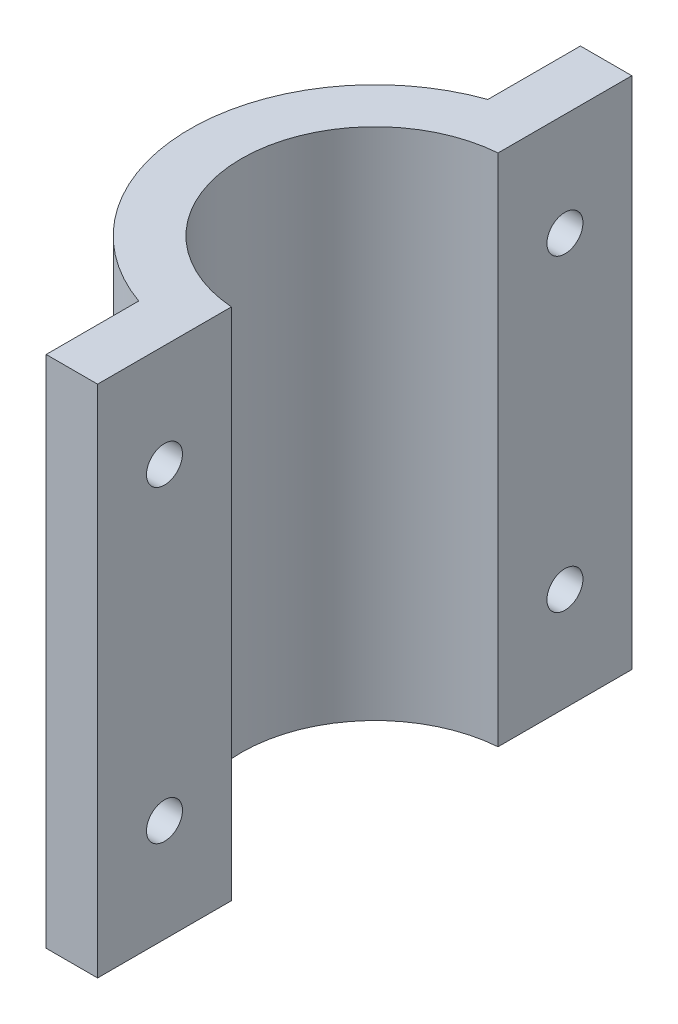
from build123d import *

# Parameters (mm, degrees)
BOSS_EXTRUDE4_DEPTH = 50
SKETCH7_R           = 1.75
CUT_EXTRUDE1_DEPTH  = 59.851254273


with BuildPart() as part:
    # Sketch6 → Boss-Extrude4 (new body)
    with BuildSketch(Plane.XZ):
        with BuildLine():
            Line((-1, 25.970562748), (-1, 12.961481397))
            ThreePointArc((-1, 12.961481397), (-13, 0), (-1, -12.961481397))
            Line((-1, -12.961481397), (-1, -25.970562748))
            Line((-1, -25.970562748), (-6, -25.970562748))
            Line((-6, -25.970562748), (-6, -16.970562748))
            ThreePointArc((-6, -16.970562748), (-18, 0), (-6, 16.970562748))
            Line((-6, 16.970562748), (-6, 25.970562748))
            Line((-6, 25.970562748), (-1, 25.970562748))
        make_face()
    extrude(amount=BOSS_EXTRUDE4_DEPTH)

    # Sketch7 → Cut-Extrude1 (cut, through all)
    with BuildSketch(Plane(origin=(-1, 0, 0), x_dir=(0, 0, -1), z_dir=(1, 0, 0))):
        with Locations((-19.466022073, -10)):
            Circle(SKETCH7_R)
        with Locations((-19.466022073, -40)):
            Circle(SKETCH7_R)
        with Locations((19.466022073, -40)):
            Circle(SKETCH7_R)
        with Locations((19.466022073, -10)):
            Circle(SKETCH7_R)
    extrude(amount=-CUT_EXTRUDE1_DEPTH, mode=Mode.SUBTRACT)


solid = part.part
